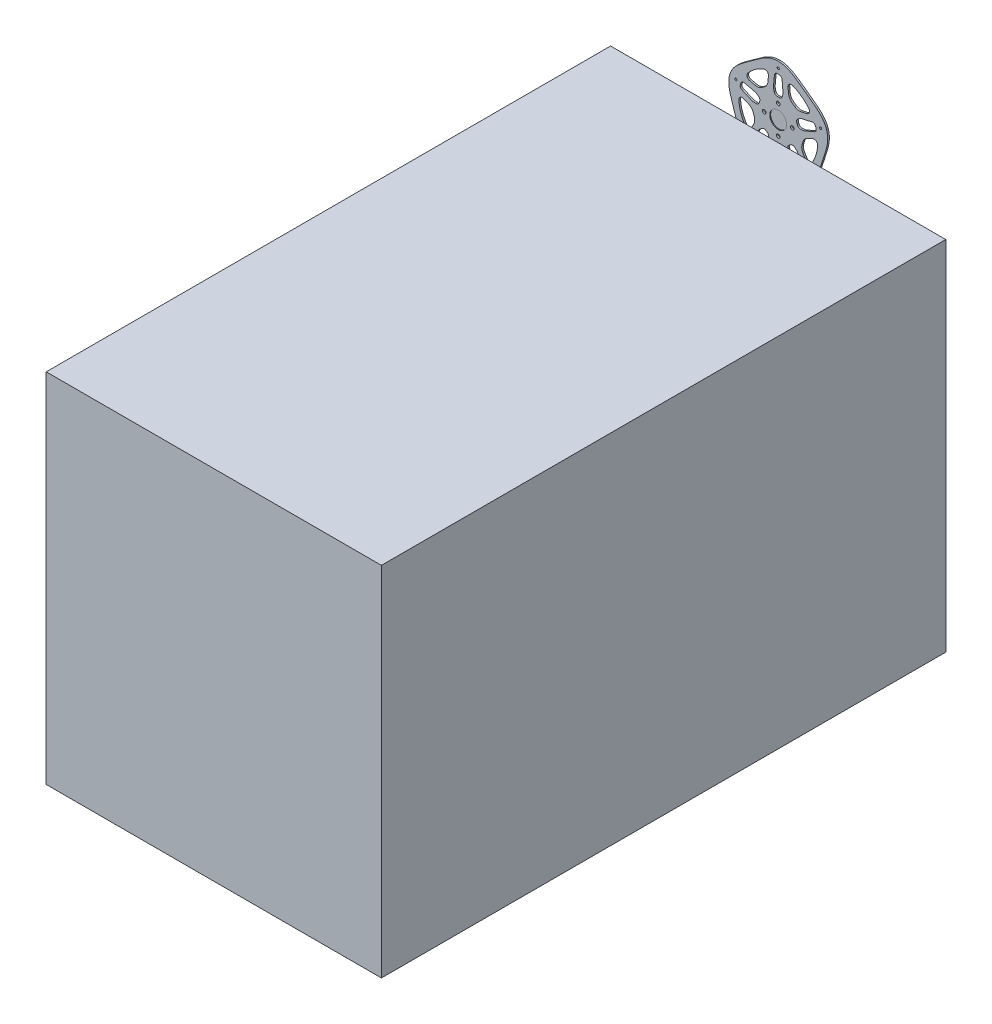
from build123d import *

# Parameters (mm, degrees)
SZKIC1_R                    = 1.9
SZKIC1_R_2                  = 3.2
DODANIE_WYCI_GNI_CIE1_DEPTH = 3
SZKIC2_R                    = 15
WYTNIJ_WYCI_GNI_CIE1_DEPTH  = 1.5
SZKIC3_W                    = 593.895792842
SZKIC3_H                    = 633.250333359
DODANIE_WYCI_GNI_CIE2_DEPTH = 1000


with BuildPart() as part:
    # Szkic1 → Dodanie-wyciągnięcie1 (new body)
    with BuildSketch(Plane.XY):
        with BuildLine():
            add(Edge.make_bspline(
                [(0, 90.000000009), (1.217332989, 89.99990734), (3.673322581, 89.885574936), (8.384242623, 89.238326941), (14.02387693, 87.720771792), (20.378150672, 85.018328924), (26.387520813, 81.676221472), (32.115008895, 77.919523903), (37.626541091, 73.960774633), (42.081531188, 70.670665496), (45.596565567, 68.138536648), (47.323168461, 66.936596905), (48.199232368, 66.340552012)],
                knots=[-4.177e-06, -4.177e-06, -4.177e-06, -4.177e-06, 0.062608961, 0.125222099, 0.250448375, 0.375674652, 0.500900928, 0.626127204, 0.75135348, 0.876579756, 0.939192894, 1.001806032, 1.001806032, 1.001806032, 1.001806032], degree=3))
            add(Edge.make_bspline(
                [(-48.199232368, 66.340552012), (-47.323168461, 66.936596905), (-45.596565567, 68.138536648), (-42.081531188, 70.670665496), (-37.626541091, 73.960774633), (-32.115008895, 77.919523903), (-26.387520813, 81.676221472), (-20.378150672, 85.018328924), (-14.02387693, 87.720771792), (-8.384242623, 89.238326941), (-3.673322581, 89.885574936), (-1.217332989, 89.99990734), (0, 90.000000009)],
                knots=[-4.177e-06, -4.177e-06, -4.177e-06, -4.177e-06, 0.062608961, 0.125222099, 0.250448375, 0.375674652, 0.500900928, 0.626127204, 0.75135348, 0.876579756, 0.939192894, 1.001806032, 1.001806032, 1.001806032, 1.001806032], degree=3))
            add(Edge.make_bspline(
                [(-85.595086475, 27.811529496), (-85.21882176, 28.969253332), (-84.35114266, 31.269707582), (-82.279818885, 35.550048155), (-79.093795329, 40.444708781), (-74.560040856, 45.652881458), (-69.524510286, 50.335364089), (-64.181787432, 54.62164556), (-58.713636028, 58.640103368), (-54.207888645, 61.860351094), (-50.713485644, 64.420876599), (-49.036823383, 65.691553726), (-48.199232368, 66.340552012)],
                knots=[-4.177e-06, -4.177e-06, -4.177e-06, -4.177e-06, 0.062608961, 0.125222099, 0.250448375, 0.375674652, 0.500900928, 0.626127204, 0.75135348, 0.876579756, 0.939192894, 1.001806032, 1.001806032, 1.001806032, 1.001806032], degree=3))
            add(Edge.make_bspline(
                [(-77.987996204, -25.339836036), (-78.284149947, -24.322461747), (-78.893712935, -22.308945007), (-80.215705218, -18.18347781), (-81.968117301, -12.929830811), (-84.029954478, -6.464731401), (-85.832895028, 0.143316853), (-87.1544306, 6.891335484), (-87.761027926, 13.769709705), (-87.461565796, 19.602270993), (-86.621380867, 24.282632827), (-85.971174923, 26.653748388), (-85.595086475, 27.811529496)],
                knots=[-4.177e-06, -4.177e-06, -4.177e-06, -4.177e-06, 0.062608961, 0.125222099, 0.250448375, 0.375674652, 0.500900928, 0.626127204, 0.75135348, 0.876579756, 0.939192894, 1.001806032, 1.001806032, 1.001806032, 1.001806032], degree=3))
            add(Edge.make_bspline(
                [(-52.900672711, -72.811529501), (-53.885461318, -72.095924152), (-55.805195735, -70.559832832), (-59.235967282, -67.267188879), (-62.906530743, -62.7245671), (-66.458790124, -56.803296499), (-69.356031221, -50.567255628), (-71.781534986, -44.161490426), (-73.913563759, -37.719197647), (-75.583848829, -32.438865964), (-76.939223383, -28.324245324), (-77.629592012, -26.336983929), (-77.987996204, -25.339836036)],
                knots=[-4.177e-06, -4.177e-06, -4.177e-06, -4.177e-06, 0.062608961, 0.125222099, 0.250448375, 0.375674652, 0.500900928, 0.626127204, 0.75135348, 0.876579756, 0.939192894, 1.001806032, 1.001806032, 1.001806032, 1.001806032], degree=3))
            add(Edge.make_bspline(
                [(0, -82.001431952), (-1.059096987, -81.968704955), (-3.162430526, -81.926222915), (-7.494501068, -81.908672817), (-13.032541395, -81.951849543), (-19.818359046, -81.914947637), (-26.660125667, -81.587646786), (-33.486249708, -80.759249367), (-40.215421216, -79.210623179), (-45.669977748, -77.123457211), (-49.861634947, -74.878082513), (-51.915775166, -73.526984909), (-52.900672711, -72.811529501)],
                knots=[-4.177e-06, -4.177e-06, -4.177e-06, -4.177e-06, 0.062608961, 0.125222099, 0.250448375, 0.375674652, 0.500900928, 0.626127204, 0.75135348, 0.876579756, 0.939192894, 1.001806032, 1.001806032, 1.001806032, 1.001806032], degree=3))
            add(Edge.make_bspline(
                [(52.900672711, -72.811529501), (51.915775166, -73.526984909), (49.861634947, -74.878082513), (45.669977748, -77.123457211), (40.215421216, -79.210623179), (33.486249708, -80.759249367), (26.660125667, -81.587646786), (19.818359046, -81.914947637), (13.032541395, -81.951849543), (7.494501068, -81.908672817), (3.162430526, -81.926222915), (1.059096987, -81.968704955), (0, -82.001431952)],
                knots=[-4.177e-06, -4.177e-06, -4.177e-06, -4.177e-06, 0.062608961, 0.125222099, 0.250448375, 0.375674652, 0.500900928, 0.626127204, 0.75135348, 0.876579756, 0.939192894, 1.001806032, 1.001806032, 1.001806032, 1.001806032], degree=3))
            add(Edge.make_bspline(
                [(77.987996204, -25.339836036), (77.629592012, -26.336983929), (76.939223383, -28.324245324), (75.583848829, -32.438865964), (73.913563759, -37.719197647), (71.781534986, -44.161490426), (69.356031221, -50.567255628), (66.458790124, -56.803296499), (62.906530743, -62.7245671), (59.235967282, -67.267188879), (55.805195735, -70.559832832), (53.885461318, -72.095924152), (52.900672711, -72.811529501)],
                knots=[-4.177e-06, -4.177e-06, -4.177e-06, -4.177e-06, 0.062608961, 0.125222099, 0.250448375, 0.375674652, 0.500900928, 0.626127204, 0.75135348, 0.876579756, 0.939192894, 1.001806032, 1.001806032, 1.001806032, 1.001806032], degree=3))
            add(Edge.make_bspline(
                [(85.595086475, 27.811529496), (85.971174923, 26.653748388), (86.621380867, 24.282632827), (87.461565796, 19.602270993), (87.761027926, 13.769709705), (87.1544306, 6.891335484), (85.832895028, 0.143316853), (84.029954478, -6.464731401), (81.968117301, -12.929830811), (80.215705218, -18.18347781), (78.893712935, -22.308945007), (78.284149947, -24.322461747), (77.987996204, -25.339836036)],
                knots=[-4.177e-06, -4.177e-06, -4.177e-06, -4.177e-06, 0.062608961, 0.125222099, 0.250448375, 0.375674652, 0.500900928, 0.626127204, 0.75135348, 0.876579756, 0.939192894, 1.001806032, 1.001806032, 1.001806032, 1.001806032], degree=3))
            add(Edge.make_bspline(
                [(48.199232368, 66.340552012), (49.036823383, 65.691553726), (50.713485644, 64.420876599), (54.207888645, 61.860351094), (58.713636028, 58.640103368), (64.181787432, 54.62164556), (69.524510286, 50.335364089), (74.560040856, 45.652881458), (79.093795329, 40.444708781), (82.279818885, 35.550048155), (84.35114266, 31.269707582), (85.21882176, 28.969253332), (85.595086475, 27.811529496)],
                knots=[-4.177e-06, -4.177e-06, -4.177e-06, -4.177e-06, 0.062608961, 0.125222099, 0.250448375, 0.375674652, 0.500900928, 0.626127204, 0.75135348, 0.876579756, 0.939192894, 1.001806032, 1.001806032, 1.001806032, 1.001806032], degree=3))
        make_face()
        with BuildLine():
            Line((41.692377179, 22.422373648), (60.109644149, 26.674334759))
            ThreePointArc((60.109644149, 26.674334759), (63.635583789, 26.188178637), (65.944737838, 23.479598623))
            ThreePointArc((65.944737838, 23.479598623), (66.573956141, 21.631189606), (67.151375401, 19.765950061))
            ThreePointArc((67.151375401, 19.765950061), (66.875293919, 16.217376103), (64.308504229, 13.751572218))
            Line((64.308504229, 13.751572218), (46.909382225, 6.366083103))
            ThreePointArc((46.909382225, 6.366083103), (45.350075076, 5.850695609), (43.727440774, 5.597474404))
            Line((43.727440774, 5.597474404), (39.847424773, 5.315286387))
            ThreePointArc((39.847424773, 5.315286387), (35.977494902, 6.37984851), (33.644563428, 9.645898182))
            ThreePointArc((33.644563428, 9.645898182), (33.28697807, 10.815594803), (32.888740278, 11.972082648))
            ThreePointArc((32.888740278, 11.972082648), (32.856385657, 15.985635052), (35.361490774, 19.121571606))
            Line((35.361490774, 19.121571606), (38.666355612, 21.173892889))
            ThreePointArc((38.666355612, 21.173892889), (40.127934027, 21.922793143), (41.692377179, 22.422373648))
        make_face(mode=Mode.SUBTRACT)
        with BuildLine():
            ThreePointArc((41.307144276, 32.596476703), (41.292145788, 32.593005921), (41.277150869, 32.589519748))
            ThreePointArc((41.277150869, 32.589519748), (34.897459984, 32.4961817), (29.056112863, 35.062858849))
            Line((29.056112863, 35.062858849), (24.367927723, 38.469024732))
            ThreePointArc((24.367927723, 38.469024732), (20.121797165, 43.231329118), (18.239134021, 49.327618749))
            ThreePointArc((18.239134021, 49.327618749), (18.237815884, 49.342957051), (18.236482006, 49.358293991))
            Line((18.236482006, 49.358293991), (17.387725255, 59.059628046))
            ThreePointArc((17.387725255, 59.059628046), (19.771267073, 64.387336119), (25.555352204, 65.168427737))
            ThreePointArc((25.555352204, 65.168427737), (41.14496766, 56.631189606), (54.081819728, 44.442735907))
            ThreePointArc((54.081819728, 44.442735907), (55.126338057, 38.700373469), (50.795941506, 34.787138155))
            Line((50.795941506, 34.787138155), (41.307144276, 32.596476703))
        make_face(mode=Mode.SUBTRACT)
        with Locations((-46.435034931, -63.912342556)):
            Circle(SZKIC1_R, mode=Mode.SUBTRACT)
        with Locations((46.435034931, -63.912342556)):
            Circle(SZKIC1_R, mode=Mode.SUBTRACT)
        with BuildLine():
            ThreePointArc((1.952380588, 69.972767632), (5.241961105, 68.613628881), (6.793898323, 65.410491515))
            Line((6.793898323, 65.410491515), (8.441291485, 46.580701507))
            ThreePointArc((8.441291485, 46.580701507), (8.44960171, 44.938448787), (8.189007813, 43.316982206))
            Line((8.189007813, 43.316982206), (7.258393683, 39.539666812))
            ThreePointArc((7.258393683, 39.539666812), (5.050060842, 36.188112577), (1.222947547, 34.97862775))
            ThreePointArc((1.222947547, 34.97862775), (0, 35), (-1.222947547, 34.97862775))
            ThreePointArc((-1.222947547, 34.97862775), (-5.050060842, 36.188112577), (-7.258393683, 39.539666812))
            Line((-7.258393683, 39.539666812), (-8.189007813, 43.316982206))
            ThreePointArc((-8.189007813, 43.316982206), (-8.44960171, 44.938448787), (-8.441291485, 46.580701507))
            Line((-8.441291485, 46.580701507), (-6.793898323, 65.410491515))
            ThreePointArc((-6.793898323, 65.410491515), (-5.241961105, 68.613628881), (-1.952380588, 69.972767632))
            ThreePointArc((-1.952380588, 69.972767632), (0, 70), (1.952380588, 69.972767632))
        make_face(mode=Mode.SUBTRACT)
        with BuildLine():
            ThreePointArc((-54.081819728, 44.442735907), (-41.14496766, 56.631189606), (-25.555352204, 65.168427737))
            ThreePointArc((-25.555352204, 65.168427737), (-19.771267073, 64.387336119), (-17.387725255, 59.059628046))
            Line((-17.387725255, 59.059628046), (-18.236482006, 49.358293991))
            ThreePointArc((-18.236482006, 49.358293991), (-18.237815884, 49.342957051), (-18.239134021, 49.327618749))
            ThreePointArc((-18.239134021, 49.327618749), (-20.121797165, 43.231329118), (-24.367927723, 38.469024732))
            Line((-24.367927723, 38.469024732), (-29.056112863, 35.062858849))
            ThreePointArc((-29.056112863, 35.062858849), (-34.897459984, 32.4961817), (-41.277150869, 32.589519748))
            ThreePointArc((-41.277150869, 32.589519748), (-41.292145788, 32.593005921), (-41.307144276, 32.596476703))
            Line((-41.307144276, 32.596476703), (-50.795941506, 34.787138155))
            ThreePointArc((-50.795941506, 34.787138155), (-55.126338057, 38.700373469), (-54.081819728, 44.442735907))
        make_face(mode=Mode.SUBTRACT)
        with BuildLine():
            ThreePointArc((-67.151375401, 19.765950061), (-66.573956141, 21.631189606), (-65.944737838, 23.479598623))
            ThreePointArc((-65.944737838, 23.479598622), (-63.635583789, 26.188178637), (-60.109644149, 26.674334759))
            Line((-60.109644149, 26.674334759), (-41.692377179, 22.422373648))
            ThreePointArc((-41.692377179, 22.422373648), (-40.127934027, 21.922793143), (-38.666355612, 21.173892889))
            Line((-38.666355612, 21.173892889), (-35.361490774, 19.121571606))
            ThreePointArc((-35.361490774, 19.121571606), (-32.856385657, 15.985635052), (-32.888740278, 11.972082648))
            ThreePointArc((-32.888740278, 11.972082648), (-33.28697807, 10.815594803), (-33.644563428, 9.645898182))
            ThreePointArc((-33.644563428, 9.645898182), (-35.977494902, 6.37984851), (-39.847424773, 5.315286387))
            Line((-39.847424773, 5.315286387), (-43.727440774, 5.597474404))
            ThreePointArc((-43.727440774, 5.597474404), (-45.350075076, 5.850695609), (-46.909382225, 6.366083103))
            Line((-46.909382225, 6.366083103), (-64.308504229, 13.751572218))
            ThreePointArc((-64.308504229, 13.751572218), (-66.875293919, 16.217376103), (-67.151375401, 19.765950061))
        make_face(mode=Mode.SUBTRACT)
        with BuildLine():
            ThreePointArc((-58.979754969, -37.701306393), (-66.573956141, -21.631189606), (-69.875895984, -4.166432572))
            ThreePointArc((-69.875895984, -4.166432572), (-67.345653109, 1.093188698), (-61.5421467, 1.71371934))
            Line((-61.5421467, 1.71371934), (-52.577909991, -2.091373389))
            ThreePointArc((-52.577909991, -2.091373389), (-52.563735885, -2.097381358), (-52.54955562, -2.103374777))
            ThreePointArc((-52.54955562, -2.103374777), (-47.333414547, -5.777750927), (-44.116320431, -11.28769405))
            Line((-44.116320431, -11.28769405), (-42.325593053, -16.798986221))
            ThreePointArc((-42.325593053, -16.798986221), (-41.689613557, -23.147584323), (-43.749816217, -29.186187868))
            ThreePointArc((-43.749816217, -29.186187868), (-43.757765449, -29.199371596), (-43.765701147, -29.212563476))
            Line((-43.765701147, -29.212563476), (-48.781343596, -37.559994295))
            ThreePointArc((-48.781343596, -37.559994295), (-53.841217668, -40.469189938), (-58.979754969, -37.701306393))
        make_face(mode=Mode.SUBTRACT)
        with BuildLine():
            ThreePointArc((-39.5494518, -57.756738674), (-41.14496766, -56.631189606), (-42.708469951, -55.461577641))
            ThreePointArc((-42.708469951, -55.461577641), (-44.57091478, -52.42844438), (-43.943701458, -48.924846006))
            Line((-43.943701458, -48.924846006), (-34.208597653, -32.722912484))
            ThreePointArc((-34.208597653, -32.722912484), (-33.250028838, -31.389417497), (-32.086129802, -30.230796726))
            Line((-32.086129802, -30.230796726), (-29.112996874, -27.721885641))
            ThreePointArc((-29.112996874, -27.721885641), (-25.356423925, -26.308446784), (-21.549306886, -27.579473758))
            ThreePointArc((-21.549306886, -27.579473758), (-20.57248383, -28.315594803), (-19.570536189, -29.017134822))
            ThreePointArc((-19.570536189, -29.017134822), (-17.185253838, -32.245149355), (-17.368669191, -36.254639165))
            Line((-17.368669191, -36.254639165), (-18.836036827, -39.857552772))
            ThreePointArc((-18.836036827, -39.857552772), (-19.578286079, -41.322520043), (-20.550301122, -42.646245774))
            Line((-20.550301122, -42.646245774), (-32.950943056, -56.911552485))
            ThreePointArc((-32.950943056, -56.911552485), (-36.089243545, -58.590739241), (-39.5494518, -57.756738674))
        make_face(mode=Mode.SUBTRACT)
        with BuildLine():
            ThreePointArc((17.630326509, -67.743424679), (0, -70), (-17.630326509, -67.743424679))
            ThreePointArc((-17.630326509, -67.743424679), (-21.850635543, -63.711708348), (-20.647413146, -58.000491247))
            Line((-20.647413146, -58.000491247), (-14.258453426, -50.650833829))
            ThreePointArc((-14.258453426, -50.650833829), (-14.248359468, -50.639210017), (-14.238277446, -50.627575852))
            ThreePointArc((-14.238277446, -50.627575852), (-9.131861829, -46.802175569), (-2.897457762, -45.44520331))
            Line((-2.897457762, -45.44520331), (2.897457762, -45.44520331))
            ThreePointArc((2.897457762, -45.44520331), (9.131861829, -46.802175569), (14.238277446, -50.627575852))
            ThreePointArc((14.238277446, -50.627575852), (14.248359468, -50.639210017), (14.258453426, -50.650833829))
            Line((14.258453426, -50.650833829), (20.647413146, -58.000491247))
            ThreePointArc((20.647413147, -58.000491247), (21.850635543, -63.711708348), (17.630326509, -67.743424679))
        make_face(mode=Mode.SUBTRACT)
        with BuildLine():
            ThreePointArc((42.708469951, -55.461577641), (41.14496766, -56.631189606), (39.549451801, -57.756738674))
            ThreePointArc((39.549451801, -57.756738674), (36.089243545, -58.590739241), (32.950943057, -56.911552485))
            Line((32.950943057, -56.911552485), (20.550301122, -42.646245774))
            ThreePointArc((20.550301122, -42.646245774), (19.578286079, -41.322520043), (18.836036827, -39.857552772))
            Line((18.836036827, -39.857552772), (17.368669191, -36.254639165))
            ThreePointArc((17.368669191, -36.254639165), (17.185253838, -32.245149355), (19.570536189, -29.017134822))
            ThreePointArc((19.570536189, -29.017134822), (20.57248383, -28.315594803), (21.549306886, -27.579473758))
            ThreePointArc((21.549306886, -27.579473758), (25.356423925, -26.308446784), (29.112996874, -27.721885641))
            Line((29.112996874, -27.721885641), (32.086129802, -30.230796726))
            ThreePointArc((32.086129802, -30.230796726), (33.250028838, -31.389417497), (34.208597653, -32.722912484))
            Line((34.208597653, -32.722912484), (43.943701458, -48.924846006))
            ThreePointArc((43.943701458, -48.924846006), (44.57091478, -52.42844438), (42.708469952, -55.461577641))
        make_face(mode=Mode.SUBTRACT)
        with BuildLine():
            ThreePointArc((69.875895984, -4.166432572), (66.573956141, -21.631189606), (58.979754969, -37.701306393))
            ThreePointArc((58.979754969, -37.701306393), (53.841217668, -40.469189938), (48.781343596, -37.559994295))
            Line((48.781343596, -37.559994295), (43.765701147, -29.212563476))
            ThreePointArc((43.765701147, -29.212563476), (43.757765449, -29.199371596), (43.749816217, -29.186187868))
            ThreePointArc((43.749816217, -29.186187868), (41.689613557, -23.147584323), (42.325593053, -16.798986221))
            Line((42.325593053, -16.798986221), (44.116320431, -11.28769405))
            ThreePointArc((44.116320431, -11.28769405), (47.333414547, -5.777750927), (52.54955562, -2.103374777))
            ThreePointArc((52.54955562, -2.103374777), (52.563735885, -2.097381358), (52.577909991, -2.091373389))
            Line((52.577909991, -2.091373389), (61.542146701, 1.71371934))
            ThreePointArc((61.542146701, 1.71371934), (67.345653109, 1.093188698), (69.875895984, -4.166432572))
        make_face(mode=Mode.SUBTRACT)
        with Locations((-75.133464787, 24.412342556)):
            Circle(SZKIC1_R, mode=Mode.SUBTRACT)
        with Locations((75.133464787, 24.412342556)):
            Circle(SZKIC1_R, mode=Mode.SUBTRACT)
        with Locations((0, 79)):
            Circle(SZKIC1_R, mode=Mode.SUBTRACT)
        with Locations((-25, 0)):
            Circle(SZKIC1_R_2, mode=Mode.SUBTRACT)
        with Locations((0, -25)):
            Circle(SZKIC1_R_2, mode=Mode.SUBTRACT)
        with Locations((25, 0)):
            Circle(SZKIC1_R_2, mode=Mode.SUBTRACT)
        with Locations((0, 25)):
            Circle(SZKIC1_R_2, mode=Mode.SUBTRACT)
    extrude(amount=DODANIE_WYCI_GNI_CIE1_DEPTH)

    # Szkic2 → Wytnij-wyciągnięcie1 (cut)
    with BuildSketch(Plane.XY.offset(3)):
        Circle(SZKIC2_R)
    extrude(amount=-WYTNIJ_WYCI_GNI_CIE1_DEPTH, mode=Mode.SUBTRACT)


with BuildPart() as body_2:
    # Szkic3 → Dodanie-wyciągnięcie2 (new body)
    with BuildSketch(Plane.XY.offset(3.1)):
        with Locations((0, -351.831352914)):
            Rectangle(SZKIC3_W, SZKIC3_H)
    extrude(amount=DODANIE_WYCI_GNI_CIE2_DEPTH)


solid = Compound([part.part, body_2.part])
